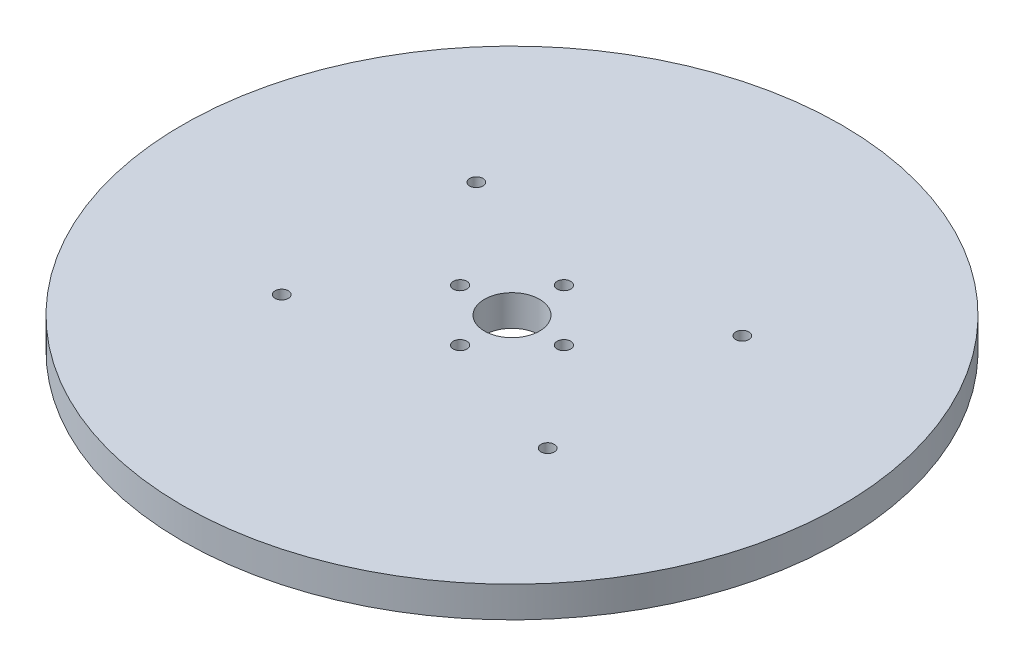
from build123d import *

# Parameters (mm, degrees)
SKETCH1_R           = 50.8
BOSS_EXTRUDE1_DEPTH = 4.7625
SKETCH2_R           = 1.05
CUT_EXTRUDE1_DEPTH  = 72.999731987
SKETCH3_R           = 4.25
CUT_EXTRUDE2_DEPTH  = 72.999731987
SKETCH4_R           = 1.025
CUT_EXTRUDE3_DEPTH  = 72.999731987
SKETCH6_R           = 15
BOSS_EXTRUDE2_DEPTH = 1.5875


with BuildPart() as part:
    # Sketch1 → Boss-Extrude1 (new body)
    with BuildSketch(Plane(origin=(0, 0, 0), x_dir=(1, 0, 0), z_dir=(0, 1, 0))):
        Circle(SKETCH1_R)
    extrude(amount=BOSS_EXTRUDE1_DEPTH)

    # Sketch2 → Cut-Extrude1 (cut, through all)
    with BuildSketch(Plane(origin=(0, 4.7625, 0), x_dir=(-1, 0, 0), z_dir=(0, 1, 0))):
        with Locations((0, 8)):
            Circle(SKETCH2_R)
        with Locations((-8, 0)):
            Circle(SKETCH2_R)
        with Locations((0, -8)):
            Circle(SKETCH2_R)
        with Locations((8, 0)):
            Circle(SKETCH2_R)
    extrude(amount=-CUT_EXTRUDE1_DEPTH, mode=Mode.SUBTRACT)

    # Sketch3 → Cut-Extrude2 (cut, through all)
    with BuildSketch(Plane(origin=(0, 4.7625, 0), x_dir=(-1, 0, 0), z_dir=(0, 1, 0))):
        Circle(SKETCH3_R)
    extrude(amount=-CUT_EXTRUDE2_DEPTH, mode=Mode.SUBTRACT)

    # Sketch4 → Cut-Extrude3 (cut, through all)
    with BuildSketch(Plane(origin=(0, 4.7625, 0), x_dir=(-1, 0, 0), z_dir=(0, 1, 0))):
        with Locations((-20.5, 15)):
            Circle(SKETCH4_R)
        with Locations((20.5, 15)):
            Circle(SKETCH4_R)
        with Locations((20.5, -15)):
            Circle(SKETCH4_R)
        with Locations((-20.5, -15)):
            Circle(SKETCH4_R)
    extrude(amount=-CUT_EXTRUDE3_DEPTH, mode=Mode.SUBTRACT)


with BuildPart() as body_2:
    # Sketch6 → Boss-Extrude2 (new body)
    with BuildSketch(Plane.XZ):
        with BuildLine():
            ThreePointArc((-13.129796139, 16.389278609), (-26.552727442, 19.428824958), (-19.593954345, 7.554929062))
            ThreePointArc((-19.593954345, 7.554929062), (-21, 0), (-19.593954345, -7.554929062))
            ThreePointArc((-19.593954345, -7.554929062), (-26.552727442, -19.428824958), (-13.129796139, -16.389278609))
            ThreePointArc((-13.129796139, -16.389278609), (0, -21), (13.129796139, -16.389278609))
            ThreePointArc((13.129796139, -16.389278609), (26.552727442, -19.428824958), (19.593954345, -7.554929062))
            ThreePointArc((19.593954345, -7.554929062), (21, 0), (19.593954345, 7.554929062))
            ThreePointArc((19.593954345, 7.554929062), (26.552727442, 19.428824958), (13.129796139, 16.389278609))
            ThreePointArc((13.129796139, 16.389278609), (0, 21), (-13.129796139, 16.389278609))
        make_face()
        Circle(SKETCH6_R, mode=Mode.SUBTRACT)
        Polygon((-17.642116168, 15), (-19.071058084, 17.475), (-21.928941916, 17.475), (-23.357883832, 15), (-21.928941916, 12.525), (-19.071058084, 12.525), align=None, mode=Mode.SUBTRACT)
        Polygon((21.928941916, 17.475), (19.071058084, 17.475), (17.642116168, 15), (19.071058084, 12.525), (21.928941916, 12.525), (23.357883832, 15), align=None, mode=Mode.SUBTRACT)
        Polygon((21.928941916, -12.525), (19.071058084, -12.525), (17.642116168, -15), (19.071058084, -17.475), (21.928941916, -17.475), (23.357883832, -15), align=None, mode=Mode.SUBTRACT)
        Polygon((-21.928941916, -12.525), (-23.357883832, -15), (-21.928941916, -17.475), (-19.071058084, -17.475), (-17.642116168, -15), (-19.071058084, -12.525), align=None, mode=Mode.SUBTRACT)
    extrude(amount=BOSS_EXTRUDE2_DEPTH)


solid = Compound([part.part, body_2.part])
